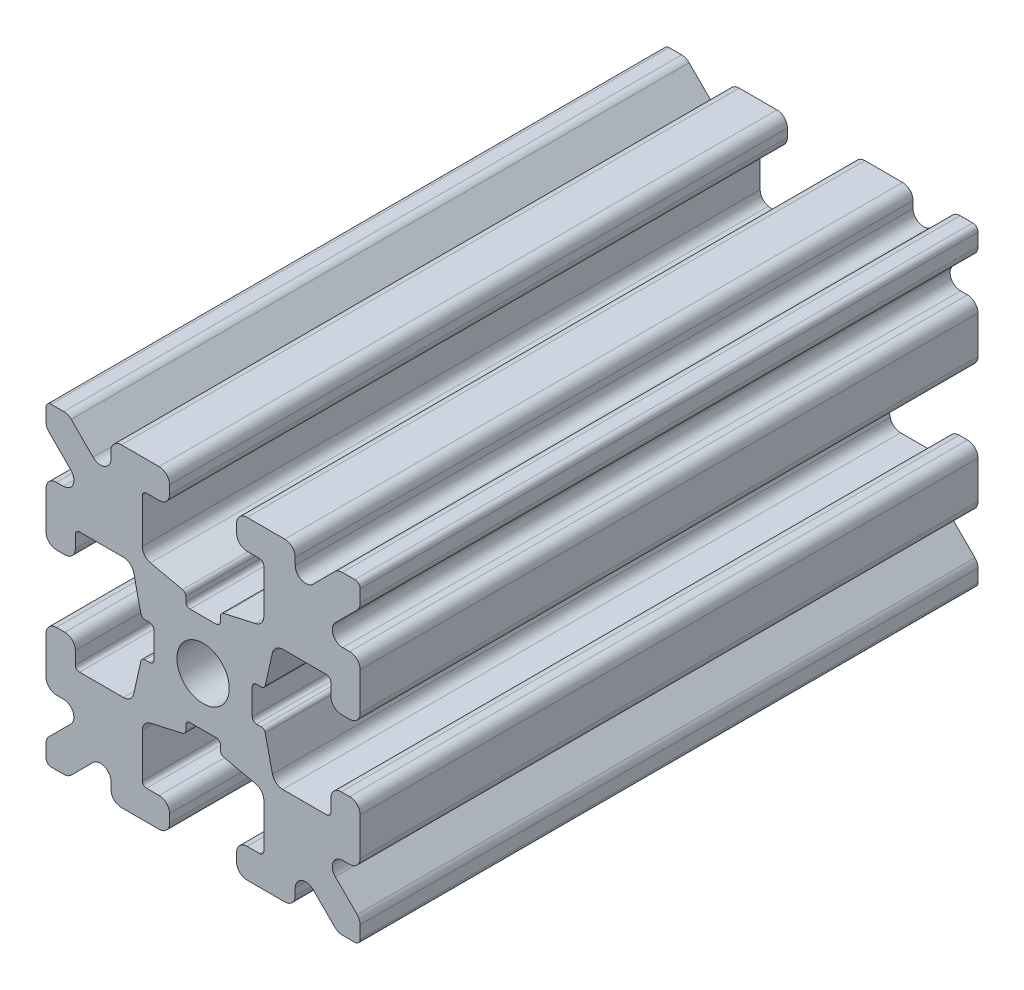
from build123d import *

# Parameters (mm, degrees)
SKETCH1_W           = 15
SKETCH1_H           = 15
SKETCH1_R           = 1.25
BOSS_EXTRUDE1_DEPTH = 14.75
FILLET1_R           = 0.25
CUT_EXTRUDE1_DEPTH  = 32.348843679
CUT_EXTRUDE3_DEPTH  = 32.348843679
FILLET3_R           = 0.5
FILLET4_R           = 0.5
FILLET5_R           = 3
FILLET6_R           = 0.2
CUT_EXTRUDE4_DEPTH  = 32.348843679
FILLET8_R           = 0.5
SKETCH6_W           = 5.1529354
SKETCH6_H           = 1.651
SKETCH6_W_2         = 1.651
SKETCH6_H_2         = 5.1529354
CUT_EXTRUDE5_DEPTH  = 32.348843679
FILLET10_R          = 0.2


with BuildPart() as part:
    # Sketch1 → Boss-Extrude1 (new, symmetric)
    with BuildSketch(Plane.XY):
        Rectangle(SKETCH1_W, SKETCH1_H)
        Circle(SKETCH1_R, mode=Mode.SUBTRACT)
    extrude(amount=BOSS_EXTRUDE1_DEPTH, both=True)

    # Fillet1
    fillet1_edges = [part.edges().sort_by_distance(p)[0] for p in [
        (7.5, -7.5, 0),
        (-7.5, -7.5, 0),
        (7.5, 7.5, 0),
        (-7.5, 7.5, 0),
    ]]
    fillet(fillet1_edges, radius=FILLET1_R)

    # Sketch2 → Cut-Extrude1 (cut, through all)
    with BuildSketch(Plane.XY.offset(14.75)):
        Polygon((-7.5, 1.6), (-6.1, 1.6), (-6.1, 2.9), (-3.4, 2.9), (-3.4, -2.9), (-6.1, -2.9), (-6.1, -1.6), (-7.5, -1.6), align=None)
        Polygon((2.9, 6.1), (1.6, 6.1), (1.6, 7.5), (-1.6, 7.5), (-1.6, 6.1), (-2.9, 6.1), (-2.9, 3.4), (2.9, 3.4), align=None)
        Polygon((-1.6, -7.5), (-1.6, -6.1), (-2.9, -6.1), (-2.9, -3.4), (2.9, -3.4), (2.9, -6.1), (1.6, -6.1), (1.6, -7.5), align=None)
        Polygon((6.1, -2.9), (6.1, -1.6), (7.5, -1.6), (7.5, 1.6), (6.1, 1.6), (6.1, 2.9), (3.4, 2.9), (3.4, -2.9), align=None)
    extrude(amount=-CUT_EXTRUDE1_DEPTH, mode=Mode.SUBTRACT)

    # Sketch4 → Cut-Extrude3 (cut, through all)
    with BuildSketch(Plane.XY.offset(14.75)):
        Polygon((-3.4, 2.9), (-2.75, 0), (-3.4, -2.9), align=None)
        Polygon((-2.9, 3.4), (0, 2.75), (2.9, 3.4), align=None)
        Polygon((3.4, 2.9), (2.75, 0), (3.4, -2.9), align=None)
        Polygon((-2.9, -3.4), (0, -2.75), (2.9, -3.4), align=None)
    extrude(amount=-CUT_EXTRUDE3_DEPTH, mode=Mode.SUBTRACT)

    # Fillet3
    fillet3_edges = [part.edges().sort_by_distance(p)[0] for p in [
        (-6.1, -1.6, 0),
        (-7.5, -1.6, 0),
        (-6.1, 1.6, 0),
        (-7.5, 1.6, 0),
        (-1.6, -7.5, 0),
        (-1.6, -6.1, 0),
        (1.6, -7.5, 0),
        (1.6, -6.1, 0),
        (6.1, -1.6, 0),
        (7.5, -1.6, 0),
        (7.5, 1.6, 0),
        (6.1, 1.6, 0),
        (1.6, 7.5, 0),
        (1.6, 6.1, 0),
        (-1.6, 7.5, 0),
        (-1.6, 6.1, 0),
    ]]
    fillet(fillet3_edges, radius=FILLET3_R)

    # Fillet4
    fillet4_edges = [part.edges().sort_by_distance(p)[0] for p in [
        (-3.4, 2.9, 0),
        (-3.4, -2.9, 0),
        (2.9, -3.4, 0),
        (-2.9, -3.4, 0),
        (3.4, -2.9, 0),
        (3.4, 2.9, 0),
        (-2.9, 3.4, 0),
        (2.9, 3.4, 0),
    ]]
    fillet(fillet4_edges, radius=FILLET4_R)

    # Fillet5
    fillet5_edges = [part.edges().sort_by_distance(p)[0] for p in [
        (0, -2.75, 0),
        (2.75, 0, 0),
        (-2.75, 0, 0),
        (0, 2.75, 0),
    ]]
    fillet(fillet5_edges, radius=FILLET5_R)

    # Fillet6
    fillet6_edges = [part.edges().sort_by_distance(p)[0] for p in [
        (-2.9, -6.1, 0),
        (2.9, -6.1, 0),
        (6.1, -2.9, 0),
        (6.1, 2.9, 0),
        (2.9, 6.1, 0),
        (-2.9, 6.1, 0),
        (-6.1, -2.9, 0),
        (-6.1, 2.9, 0),
    ]]
    fillet(fillet6_edges, radius=FILLET6_R)

    # Sketch5 → Cut-Extrude4 (cut, through all)
    with BuildSketch(Plane.XY.offset(14.75)):
        Polygon((-7.5, 6.439339828), (-5.460660172, 4.4), (-7.5, 4.4), align=None)
        Polygon((-6.439339828, 7.5), (-4.4, 5.460660172), (-4.4, 7.5), align=None)
        Polygon((4.4, 7.5), (6.439339828, 7.5), (4.4, 5.460660172), align=None)
        Polygon((7.5, 6.439339828), (7.5, 4.4), (5.460660172, 4.4), align=None)
        Polygon((7.5, -6.439339828), (5.460660172, -4.4), (7.5, -4.4), align=None)
        Polygon((6.439339828, -7.5), (4.4, -5.460660172), (4.4, -7.5), align=None)
        Polygon((-4.4, -7.5), (-6.439339828, -7.5), (-4.4, -5.460660172), align=None)
        Polygon((-7.5, -6.439339828), (-7.5, -4.4), (-5.460660172, -4.4), align=None)
    extrude(amount=-CUT_EXTRUDE4_DEPTH, mode=Mode.SUBTRACT)

    # Fillet8
    fillet8_edges = [part.edges().sort_by_distance(p)[0] for p in [
        (-5.460660172, 4.4, 0),
        (-7.5, 4.4, 0),
        (-5.460660172, -4.4, 0),
        (-7.5, -4.4, 0),
        (-4.4, -7.5, 0),
        (-4.4, -5.460660172, 0),
        (4.4, -7.5, 0),
        (4.4, -5.460660172, 0),
        (5.460660172, -4.4, 0),
        (7.5, -4.4, 0),
        (7.5, 4.4, 0),
        (5.460660172, 4.4, 0),
        (4.4, 5.460660172, 0),
        (4.4, 7.5, 0),
        (-4.4, 5.460660172, 0),
        (-4.4, 7.5, 0),
        (-6.439339828, 7.5, 0),
        (-7.5, 6.439339828, 0),
        (6.439339828, 7.5, 0),
        (7.5, 6.439339828, 0),
        (6.439339828, -7.5, 0),
        (7.5, -6.439339828, 0),
        (-6.439339828, -7.5, 0),
        (-7.5, -6.439339828, 0),
    ]]
    fillet(fillet8_edges, radius=FILLET8_R)

    # Sketch6 → Cut-Extrude5 (cut, through all)
    with BuildSketch(Plane.XY.offset(14.75)):
        with Locations((4.9235323, 0)):
            Rectangle(SKETCH6_W, SKETCH6_H)
        with Locations((0, -4.9235323)):
            Rectangle(SKETCH6_W_2, SKETCH6_H_2)
        with Locations((-4.9235323, 0)):
            Rectangle(SKETCH6_W, SKETCH6_H)
        with Locations((0, 4.9235323)):
            Rectangle(SKETCH6_W_2, SKETCH6_H_2)
    extrude(amount=-CUT_EXTRUDE5_DEPTH, mode=Mode.SUBTRACT)

    # Fillet10
    fillet10_edges = [part.edges().sort_by_distance(p)[0] for p in [
        (-2.935025862, 0.8255, 0),
        (-2.935025862, -0.8255, 0),
        (2.935025862, -0.8255, 0),
        (2.935025862, 0.8255, 0),
        (0.8255, 2.935025862, 0),
        (-0.8255, 2.935025862, 0),
        (-2.3470646, 0.8255, 0),
        (-2.3470646, -0.8255, 0),
        (0.8255, 2.3470646, 0),
        (-0.8255, 2.3470646, 0),
        (2.3470646, 0.8255, 0),
        (2.3470646, -0.8255, 0),
        (0.8255, -2.935025862, 0),
        (0.8255, -2.3470646, 0),
        (-0.8255, -2.3470646, 0),
        (-0.8255, -2.935025862, 0),
    ]]
    fillet(fillet10_edges, radius=FILLET10_R)


solid = part.part
